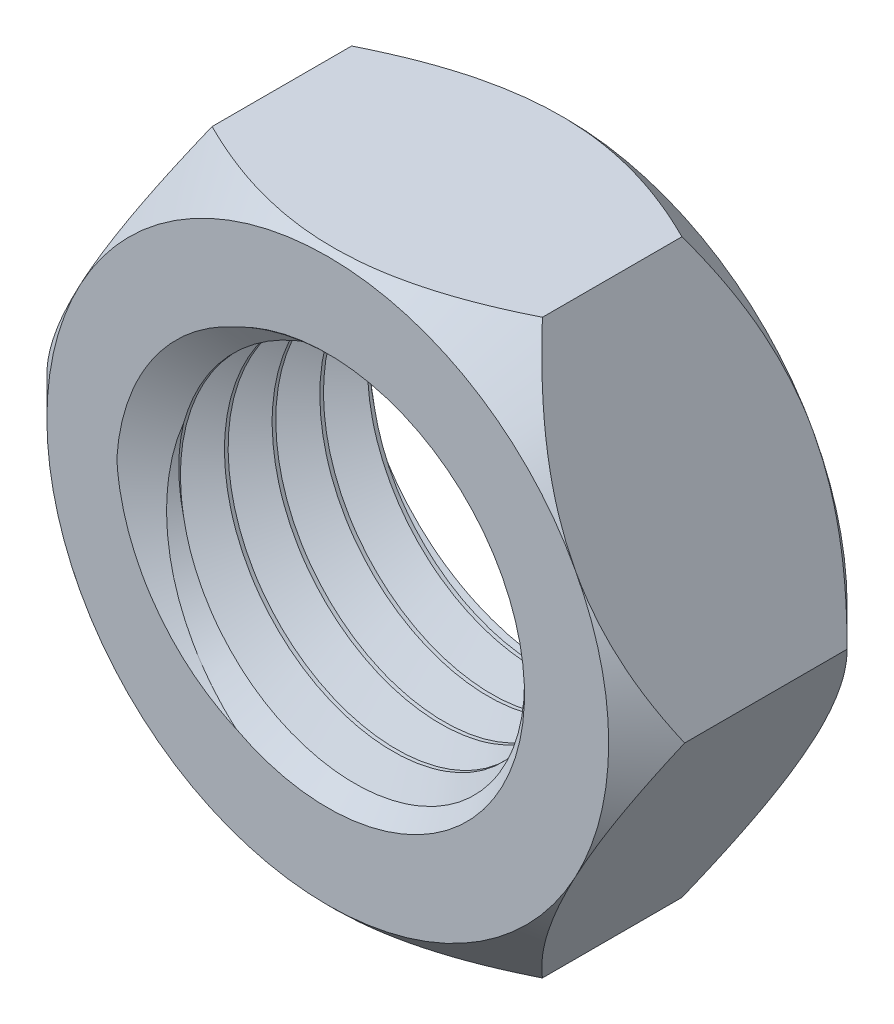
from build123d import *

# Parameters (mm, degrees)
AUFSATZ_LINEAR_AUSTRAGEN1_DEPTH = 10
SKIZZE2_OUTSIDE_W               = 56.21
SKIZZE2_OUTSIDE_H               = 53.46
SKIZZE2_OUTSIDE_R               = 11.78233764
SCHNITT_LINEAR_AUSTRAGEN1_DEPTH = 10
SCHNITT_LINEAR_AUSTRAGEN1_DRAFT = -45
SKIZZE3_OUTSIDE_W               = 56.21
SKIZZE3_OUTSIDE_H               = 53.46
SKIZZE3_OUTSIDE_R               = 11.78233764
SCHNITT_LINEAR_AUSTRAGEN2_DEPTH = 10
SCHNITT_LINEAR_AUSTRAGEN2_DRAFT = -45
SKIZZE4_R                       = 7.25
SCHNITT_LINEAR_AUSTRAGEN3_DEPTH = 21.564304632
FASE1_SIZE                      = 1
SCHNITT_AUSTRAGUNG1_PITCH       = 2


with BuildPart() as part:
    # Skizze1 → Aufsatz-Linear austragen1 (new body)
    with BuildSketch(Plane.XY):
        Polygon((13.375, 0), (6.92820323, 12), (-6.92820323, 12), (-13.375, 0), (-6.92820323, -12), (6.92820323, -12), align=None)
    extrude(amount=AUFSATZ_LINEAR_AUSTRAGEN1_DEPTH)


with BuildPart() as schnitt_linear_austragen1_tool:
    # Skizze2 outside → Schnitt-Linear austragen1 (with draft: the straight prism first)
    with BuildSketch(Plane.XY.offset(10)):
        Rectangle(SKIZZE2_OUTSIDE_W, SKIZZE2_OUTSIDE_H)
        Circle(SKIZZE2_OUTSIDE_R, mode=Mode.SUBTRACT)
    extrude(amount=-SCHNITT_LINEAR_AUSTRAGEN1_DEPTH)
    # Schnitt-Linear austragen1: the draft: its side faces are tilted about the plane it starts from
    schnitt_linear_austragen1_sides = [schnitt_linear_austragen1_tool.faces().sort_by_distance(p)[0] for p in [
        (0, -26.73, 5),
        (28.105, 0, 5),
        (0, 26.73, 5),
        (-28.105, 0, 5),
        (-11.78233764, 0, 5),
    ]]
    draft(schnitt_linear_austragen1_sides, Plane.XY.offset(10), SCHNITT_LINEAR_AUSTRAGEN1_DRAFT)


with BuildPart() as part_1:
    add(part.part)

    # Schnitt-Linear austragen1: cut by schnitt_linear_austragen1_tool
    add(schnitt_linear_austragen1_tool.part, mode=Mode.SUBTRACT)


with BuildPart() as schnitt_linear_austragen2_tool:
    # Skizze3 outside → Schnitt-Linear austragen2 (with draft: the straight prism first)
    with BuildSketch(Plane(origin=(0, 0, 0), x_dir=(-1, 0, 0), z_dir=(0, 0, -1))):
        Rectangle(SKIZZE3_OUTSIDE_W, SKIZZE3_OUTSIDE_H)
        Circle(SKIZZE3_OUTSIDE_R, mode=Mode.SUBTRACT)
    extrude(amount=-SCHNITT_LINEAR_AUSTRAGEN2_DEPTH)
    # Schnitt-Linear austragen2: the draft: its side faces are tilted about the plane it starts from
    schnitt_linear_austragen2_sides = [schnitt_linear_austragen2_tool.faces().sort_by_distance(p)[0] for p in [
        (0, -26.73, 5),
        (-28.105, 0, 5),
        (0, 26.73, 5),
        (28.105, 0, 5),
        (11.78233764, 0, 5),
    ]]
    draft(schnitt_linear_austragen2_sides, Plane(origin=(0, 0, 0), x_dir=(-1, 0, 0), z_dir=(0, 0, -1)), SCHNITT_LINEAR_AUSTRAGEN2_DRAFT)


with BuildPart() as part_2:
    add(part_1.part)

    # Schnitt-Linear austragen2: cut by schnitt_linear_austragen2_tool
    add(schnitt_linear_austragen2_tool.part, mode=Mode.SUBTRACT)

    # Skizze4 → Schnitt-Linear austragen3 (cut, through all)
    with BuildSketch(Plane(origin=(0, 0, 0), x_dir=(-1, 0, 0), z_dir=(0, 0, -1))):
        Circle(SKIZZE4_R)
    extrude(amount=-SCHNITT_LINEAR_AUSTRAGEN3_DEPTH, mode=Mode.SUBTRACT)

    # Fase1
    fase1_edges = [part_2.edges().sort_by_distance(p)[0] for p in [
        (7.25, 0, 10),
        (7.25, 0, 0),
    ]]
    chamfer(fase1_edges, length=FASE1_SIZE)

    # Schnitt-Austragung1: arcs per turn and ends read off the stored shape
    # Schnitt-Austragung1: the profile of Skizze6 screwed along a right-hand helix through 8 turns, 10 arcs to a turn; built about Z, then put on its axis
    schnitt_austragung1_z = Axis((0, 0, 0), (0, 0, 1))
    schnitt_austragung1_corners = [(8.85, 0, 0), (6.6, 0, 1.299038106), (6.6, 0, -1.299038106)]
    with BuildLine(mode=Mode.PRIVATE) as schnitt_austragung1_profile:
        Line(schnitt_austragung1_corners[0], schnitt_austragung1_corners[1])
        Line(schnitt_austragung1_corners[1], schnitt_austragung1_corners[2])
        Line(schnitt_austragung1_corners[2], schnitt_austragung1_corners[0])
    schnitt_austragung1_cap = Face(schnitt_austragung1_profile.wire())
    schnitt_austragung1_turn_angles = [0, 18, 36, 54, 72, 90, 108, 126, 144, 162, 180, 198, 216, 234, 252, 270, 288, 306, 324, 342, 360]
    schnitt_austragung1_turn_weights = [1, 0.9510565162951535, 1, 0.9510565162951535, 1, 0.9510565162951535, 1, 0.9510565162951535, 1, 0.9510565162951535, 1, 0.9510565162951535, 1, 0.9510565162951535, 1, 0.9510565162951535, 1, 0.9510565162951535, 1, 0.9510565162951535, 1]
    schnitt_austragung1_turn_rails = [Edge.make_bspline([Vector(p[0], p[1], 0).rotate(schnitt_austragung1_z, schnitt_austragung1_turn_angles[k]) / schnitt_austragung1_turn_weights[k] + Vector(0, 0, p[2] + SCHNITT_AUSTRAGUNG1_PITCH * schnitt_austragung1_turn_angles[k] / 360) for k in range(21)], [0, 0, 0, 1, 1, 2, 2, 3, 3, 4, 4, 5, 5, 6, 6, 7, 7, 8, 8, 9, 9, 10, 10, 10], 2, schnitt_austragung1_turn_weights) for p in schnitt_austragung1_corners]
    schnitt_austragung1_turn_sides = [Face.make_surface_from_curves(schnitt_austragung1_turn_rails[p[0]], schnitt_austragung1_turn_rails[p[1]]) for p in [(0, 1), (1, 2), (2, 0)]]
    schnitt_austragung1 = Plane(origin=(0, 0, 0), x_dir=(-1, 0, 0), z_dir=(0, 0, 1)) * Solid(Shell([*[p.moved(Location((0, 0, SCHNITT_AUSTRAGUNG1_PITCH * i))) for i in range(8) for p in schnitt_austragung1_turn_sides], schnitt_austragung1_cap, schnitt_austragung1_cap.rotate(schnitt_austragung1_z, 2880).moved(Location((0, 0, SCHNITT_AUSTRAGUNG1_PITCH * 2880 / 360)))]))
    add(schnitt_austragung1, mode=Mode.SUBTRACT)

    # Verrundung1: read off the stored shape, not the designer's step
    # Verrundung1 outline → Verrundung1 (revolve, cut)
    with BuildSketch(Plane.XZ):
        with BuildLine():
            ThreePointArc((9.078427125, 0), (8.31306026, 0.152240935), (7.664213562, 0.585786438))
            Line((7.664213562, 0.585786438), (7.664213562, 0))
            Line((7.664213562, 0), (9.078427125, 0))
        make_face()
    revolve(axis=Axis((0, 0, 0), (0, 0, 1)), mode=Mode.SUBTRACT)


solid = part_2.part
